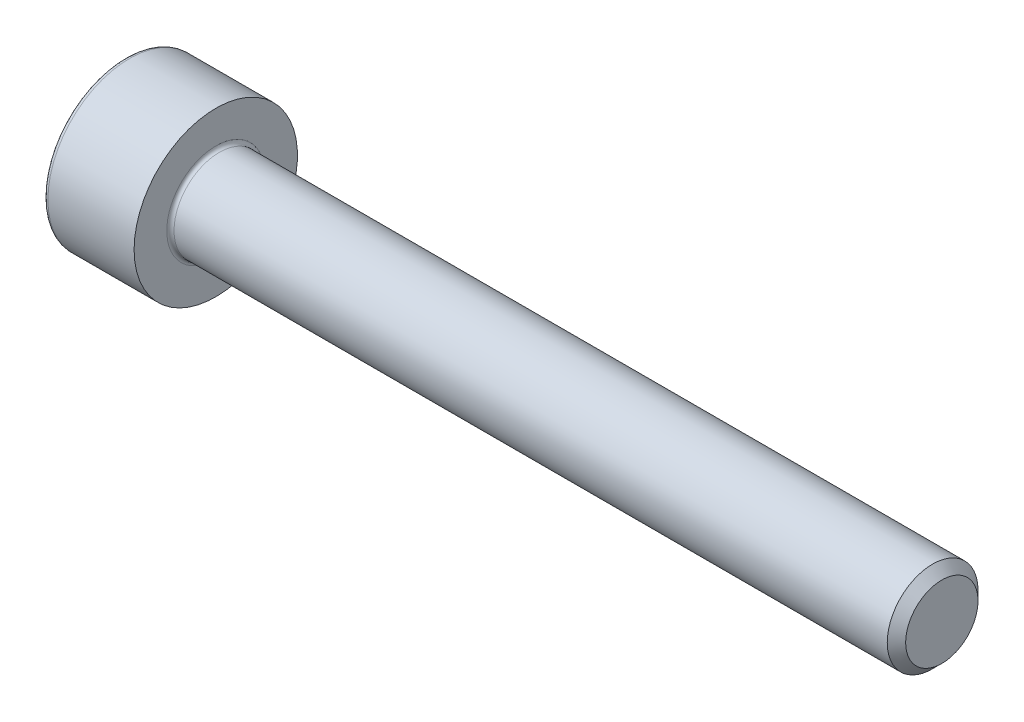
from build123d import *

# Parameters (mm, degrees)
FILLET1_R   = 0.1
FILLET2_R   = 0.125
HEX_2_DEPTH = 1.1


with BuildPart() as part:
    # BodySke → Base-Revolve (revolve)
    with BuildSketch(Plane.XY):
        Polygon((0, 0), (0, 2.25), (2.5, 2.25), (2.5, 1.25), (22.2465, 1.25), (22.5, 0.9965), (22.5, 0), align=None)
    revolve(axis=Axis((-31.75, 0, 0), (1, 0, 0)))

    # Fillet1
    fillet1_edges = [part.edges().sort_by_distance(p)[0] for p in [
        (2.5, -1.25, 0),
    ]]
    fillet(fillet1_edges, radius=FILLET1_R)

    # Fillet2
    fillet2_edges = [part.edges().sort_by_distance(p)[0] for p in [
        (0, -2.25, 0),
    ]]
    fillet(fillet2_edges, radius=FILLET2_R)

    # Sketch2 → Hex-PreBroach (revolve, cut)
    with BuildSketch(Plane.XY):
        Polygon((0, 1.0225), (1.1, 1.0225), (1.69034065, 0), (0, 0), align=None)
    revolve(axis=Axis((0, 0, 0), (1, 0, 0)), mode=Mode.SUBTRACT)

    # Sketch3 → Hex 2 (cut)
    with BuildSketch(Plane(origin=(0, 0, 0), x_dir=(0, 0.500000000000001, 0.866025403784438), z_dir=(-1, 0, 0))):
        Polygon((0.59034065, 1.0225), (-0.59034065, 1.0225), (-1.1806813, 0), (-0.59034065, -1.0225), (0.59034065, -1.0225), (1.1806813, 0), align=None)
    extrude(amount=-HEX_2_DEPTH, mode=Mode.SUBTRACT)


solid = part.part
